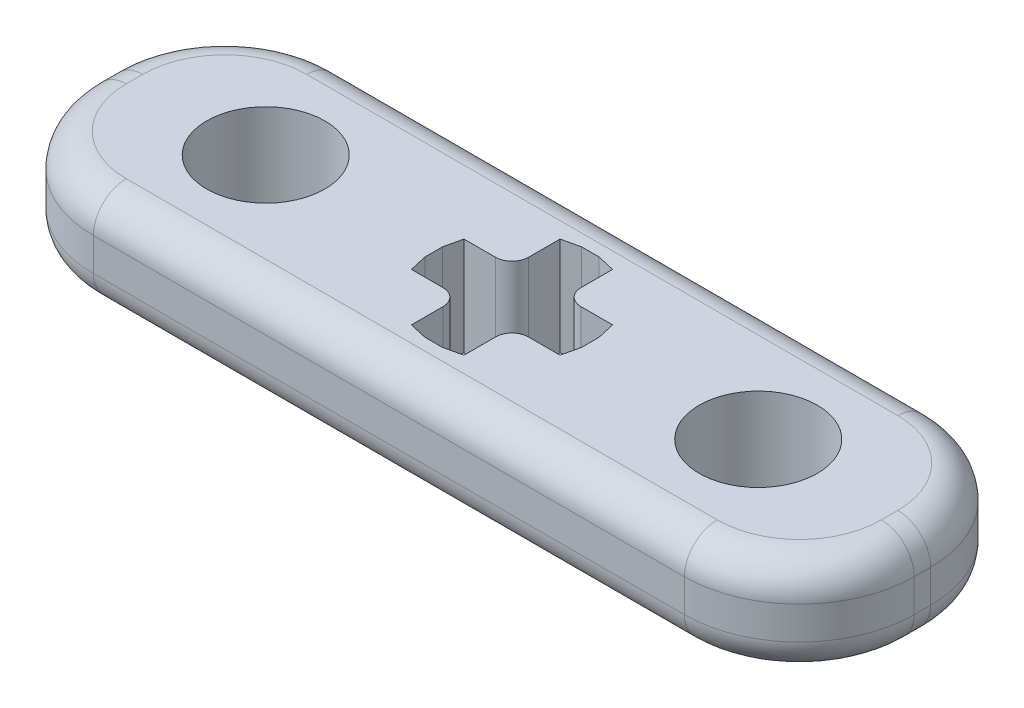
from build123d import *

# Parameters (mm, degrees)
SKETCH1_W            = 25
SKETCH1_H            = 7.5
BOSS_EXTRUDE1_DEPTH  = 3
FILLET4_R            = 3.5
M3_CLEARANCE_HOLE1_D = 3.6
FILLET6_R            = 1
FILLET7_R            = 0.5


with BuildPart() as part:
    # Sketch1 → Boss-Extrude1 (new body)
    with BuildSketch(Plane(origin=(0, 0, 0), x_dir=(1, 0, 0), z_dir=(0, 1, 0))):
        Rectangle(SKETCH1_W, SKETCH1_H)
        Polygon((-0.8, 0.8), (-0.8, 2.2627417), (-0.270125178, 2.384749963), (0.270125178, 2.384749963), (0.8, 2.2627417), (0.8, 0.8), (2.2627417, 0.8), (2.384749963, 0.270125178), (2.384749963, -0.270125178), (2.2627417, -0.8), (0.8, -0.8), (0.8, -2.2627417), (0.270125178, -2.384749963), (-0.270125178, -2.384749963), (-0.8, -2.2627417), (-0.8, -0.8), (-2.2627417, -0.8), (-2.384749963, -0.270125178), (-2.384749963, 0.270125178), (-2.2627417, 0.8), align=None, mode=Mode.SUBTRACT)
    extrude(amount=BOSS_EXTRUDE1_DEPTH)

    # Fillet4
    fillet4_edges = [part.edges().sort_by_distance(p)[0] for p in [
        (12.5, 1.5, -3.75),
        (12.5, 1.5, 3.75),
        (-12.5, 1.5, 3.75),
        (-12.5, 1.5, -3.75),
    ]]
    fillet(fillet4_edges, radius=FILLET4_R)

    # M3 Clearance Hole1 (through all)
    with Locations(Plane.XZ):
        with Locations((-7.5, 0), (7.5, 0)):
            Hole(M3_CLEARANCE_HOLE1_D / 2)

    # Fillet6
    fillet6_edges = [part.edges().sort_by_distance(p)[0] for p in [
        (-11.474873734, 3, 2.724873734),
        (0, 3, 3.75),
        (11.474873734, 3, 2.724873734),
        (11.474873734, 3, -2.724873734),
        (0, 3, -3.75),
        (-11.474873734, 3, -2.724873734),
        (-11.474873734, 0, 2.724873734),
        (0, 0, 3.75),
        (11.474873734, 0, 2.724873734),
        (11.474873734, 0, -2.724873734),
        (0, 0, -3.75),
        (-11.474873734, 0, -2.724873734),
        (12.5, 3, 0),
        (12.5, 0, 0),
        (-12.5, 3, 0),
        (-12.5, 0, 0),
    ]]
    fillet(fillet6_edges, radius=FILLET6_R)

    # Fillet7
    fillet7_edges = [part.edges().sort_by_distance(p)[0] for p in [
        (0.8, 1.5, 0.8),
        (-0.8, 1.5, 0.8),
        (0.8, 1.5, -0.8),
        (-0.8, 1.5, -0.8),
    ]]
    fillet(fillet7_edges, radius=FILLET7_R)


solid = part.part
